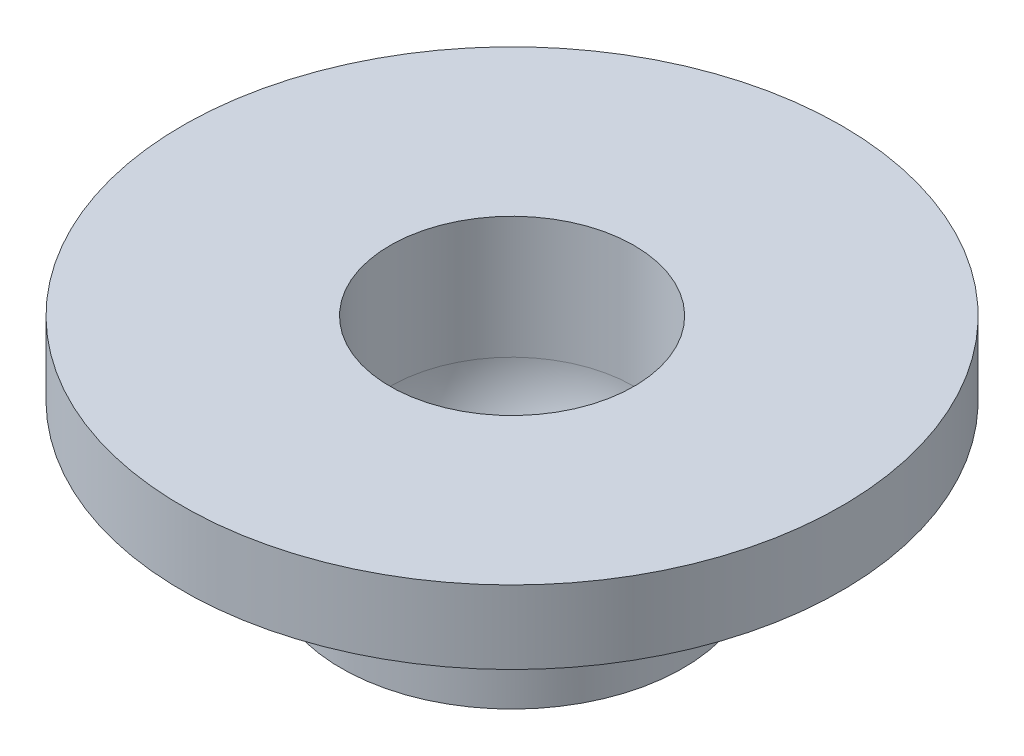
from build123d import *

# Parameters (mm, degrees)
FILLET2_R = 2


with BuildPart() as part:
    # Sketch1 → Revolve1 (revolve)
    with BuildSketch(Plane(origin=(0, 0, 0), x_dir=(0, 0, -1), z_dir=(1, 0, 0))):
        with BuildLine():
            Line((-13.5, 5), (-5, 5))
            Line((-5, 5), (-5, 0))
            ThreePointArc((-5, 0), (-4.472135955, -2.236067977), (-3, -4))
            Line((-3, -4), (-7, -4))
            Line((-7, -4), (-7, 2))
            Line((-7, 2), (-13.5, 2))
            Line((-13.5, 2), (-13.5, 5))
        make_face()
    revolve(axis=Axis((0, 0, 0), (0, 1, 0)))

    # Fillet2
    fillet2_edges = [part.edges().sort_by_distance(p)[0] for p in [
        (0, 2, -7),
    ]]
    fillet(fillet2_edges, radius=FILLET2_R)


solid = part.part
